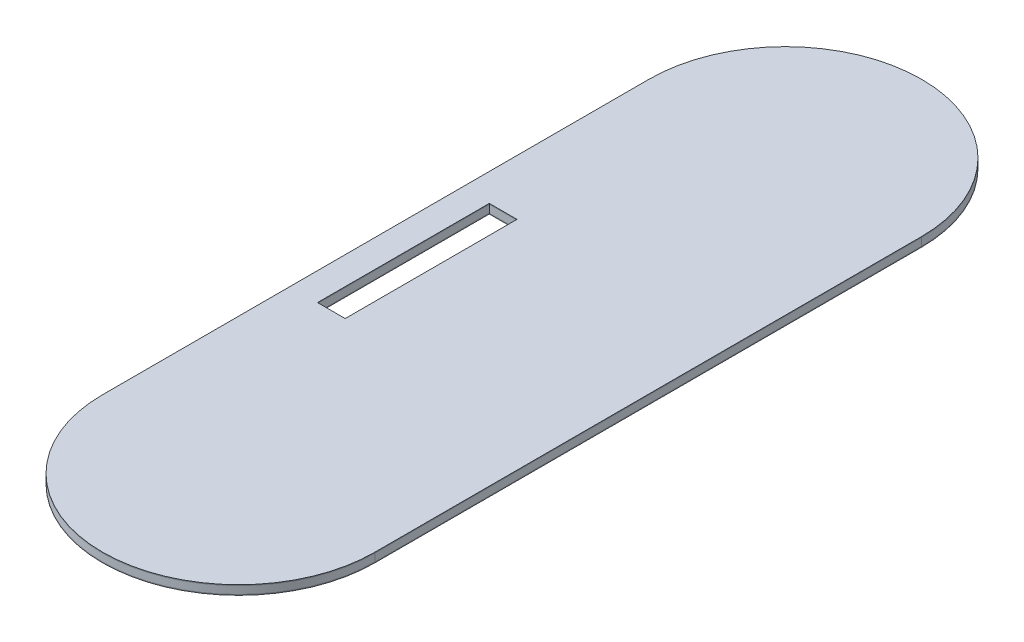
from build123d import *

# Parameters (mm, degrees)
SKETCH1_W           = 9
SKETCH1_H           = 55.88
BOSS_EXTRUDE1_DEPTH = 0.25
SKETCH2_W           = 9
SKETCH2_H           = 55.88
BOSS_EXTRUDE3_DEPTH = 2.5
SKETCH3_W           = 9
SKETCH3_H           = 55.88
BOSS_EXTRUDE4_DEPTH = 0.25


with BuildPart() as part:
    # Sketch1 → Boss-Extrude1 (new body)
    with BuildSketch(Plane(origin=(0, 0, 0), x_dir=(1, 0, 0), z_dir=(0, 1, 0))):
        with BuildLine():
            Line((44.323, 88.9), (44.323, -88.9))
            ThreePointArc((44.323, -88.9), (0, -133.223), (-44.323, -88.9))
            Line((-44.323, -88.9), (-44.323, 88.9))
            ThreePointArc((-44.323, 88.9), (0, 133.223), (44.323, 88.9))
        make_face()
        with Locations((-30.823, 0)):
            Rectangle(SKETCH1_W, SKETCH1_H, mode=Mode.SUBTRACT)
    extrude(amount=BOSS_EXTRUDE1_DEPTH)


with BuildPart() as body_2:
    # Sketch2 → Boss-Extrude3 (new body)
    with BuildSketch(Plane(origin=(0, 0.25, 0), x_dir=(1, 0, 0), z_dir=(0, 1, 0))):
        with BuildLine():
            ThreePointArc((44.323, 88.9), (0, 133.223), (-44.323, 88.9))
            Line((-44.323, 88.9), (-44.323, -88.9))
            ThreePointArc((-44.323, -88.9), (0, -133.223), (44.323, -88.9))
            Line((44.323, -88.9), (44.323, 88.9))
        make_face()
        with Locations((-30.823, 0)):
            Rectangle(SKETCH2_W, SKETCH2_H, mode=Mode.SUBTRACT)
    extrude(amount=BOSS_EXTRUDE3_DEPTH)


with BuildPart() as body_3:
    # Sketch3 → Boss-Extrude4 (new body)
    with BuildSketch(Plane(origin=(0, 2.75, 0), x_dir=(1, 0, 0), z_dir=(0, 1, 0))):
        with BuildLine():
            ThreePointArc((-44.323, -88.9), (0, -133.223), (44.323, -88.9))
            Line((44.323, -88.9), (44.323, 88.9))
            ThreePointArc((44.323, 88.9), (0, 133.223), (-44.323, 88.9))
            Line((-44.323, 88.9), (-44.323, -88.9))
        make_face()
        with Locations((-30.823, 0)):
            Rectangle(SKETCH3_W, SKETCH3_H, mode=Mode.SUBTRACT)
    extrude(amount=BOSS_EXTRUDE4_DEPTH)


solid = Compound([part.part, body_2.part, body_3.part])
